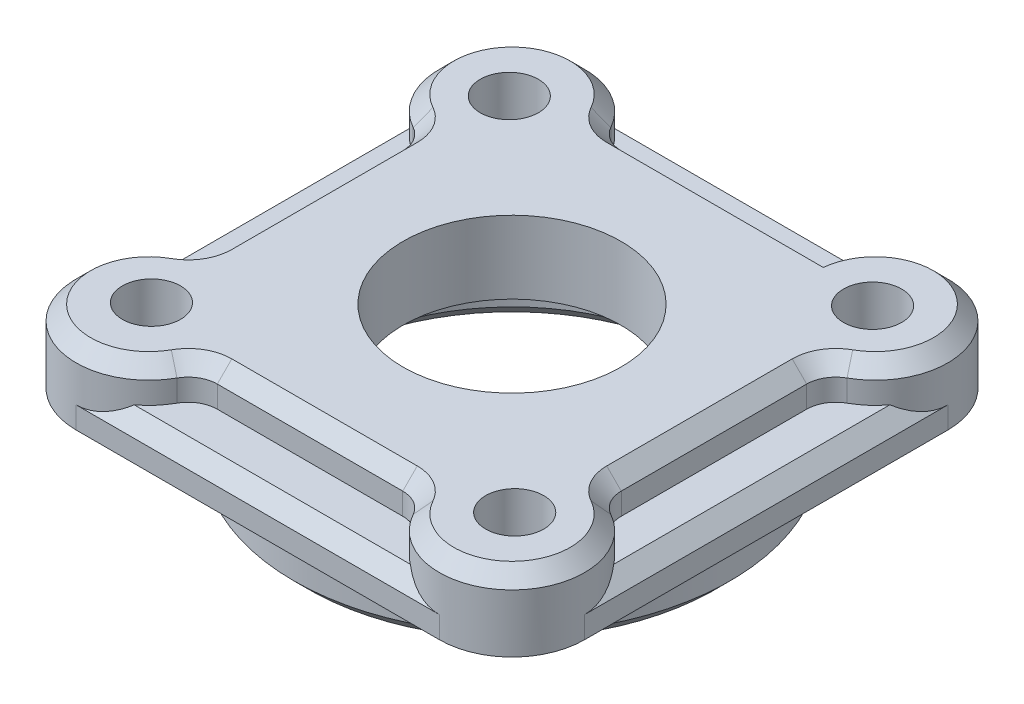
from build123d import *

# Parameters (mm, degrees)
BOSS_EXTRUDE1_DEPTH = 3.175
BOSS_EXTRUDE2_DEPTH = 3.175
SKETCH3_R           = 19.05
SKETCH3_R_2         = 15.875
BOSS_EXTRUDE3_DEPTH = 6.35
SKETCH4_R           = 2.54
CUT_EXTRUDE1_DEPTH  = 34.89972345
CHAMFER1_SIZE       = 1.27
SKETCH5_R           = 9.525
CUT_EXTRUDE2_DEPTH  = 34.89972345


with BuildPart() as part:
    # Sketch1 → Boss-Extrude1 (new body)
    with BuildSketch(Plane(origin=(0, 0, 0), x_dir=(1, 0, 0), z_dir=(0, 1, 0))):
        with BuildLine():
            Line((-15.875, -22.225), (15.875, -22.225))
            ThreePointArc((15.875, -22.225), (20.365128061, -20.365128061), (22.225, -15.875))
            Line((22.225, -15.875), (22.225, 15.875))
            ThreePointArc((22.225, 15.875), (20.365128061, 20.365128061), (15.875, 22.225))
            Line((15.875, 22.225), (-15.875, 22.225))
            ThreePointArc((-15.875, 22.225), (-20.365128061, 20.365128061), (-22.225, 15.875))
            Line((-22.225, 15.875), (-22.225, -15.875))
            ThreePointArc((-22.225, -15.875), (-20.365128061, -20.365128061), (-15.875, -22.225))
        make_face()
    extrude(amount=BOSS_EXTRUDE1_DEPTH)

    # Sketch2 → Boss-Extrude2 (add)
    with BuildSketch(Plane(origin=(0, 3.175, 0), x_dir=(1, 0, 0), z_dir=(0, 1, 0))):
        with BuildLine():
            Line((9.779188038, 17.653644576), (-8.104452463, 17.653644576))
            ThreePointArc((-8.104452463, 17.653644576), (-9.392376749, 18.004386475), (-10.324608902, 18.959746126))
            ThreePointArc((-10.324608902, 18.959746126), (-12.655189283, 21.348145252), (-15.875, 22.225))
            ThreePointArc((-15.875, 22.225), (-20.365128061, 20.365128061), (-22.225, 15.875))
            ThreePointArc((-22.225, 15.875), (-21.348011707, 12.654962289), (-18.959285714, 10.324353044))
            ThreePointArc((-18.959285714, 10.324353044), (-18.003795317, 9.392109345), (-17.653, 8.104094261))
            Line((-17.653, 8.104094261), (-17.653, -8.104094261))
            ThreePointArc((-17.653, -8.104094261), (-18.003795317, -9.392109345), (-18.959285714, -10.324353044))
            ThreePointArc((-18.959285714, -10.324353044), (-21.348011707, -12.654962289), (-22.225, -15.875))
            ThreePointArc((-22.225, -15.875), (-20.365128061, -20.365128061), (-15.875, -22.225))
            ThreePointArc((-15.875, -22.225), (-12.655189283, -21.348145252), (-10.324608902, -18.959746126))
            ThreePointArc((-10.324608902, -18.959746126), (-9.392376749, -18.004386475), (-8.104452463, -17.653644576))
            Line((-8.104452463, -17.653644576), (8.104452463, -17.653644576))
            ThreePointArc((8.104452463, -17.653644576), (9.392376749, -18.004386475), (10.324608902, -18.959746126))
            ThreePointArc((10.324608902, -18.959746126), (12.655189283, -21.348145252), (15.875, -22.225))
            ThreePointArc((15.875, -22.225), (20.365128061, -20.365128061), (22.225, -15.875))
            ThreePointArc((22.225, -15.875), (21.348011707, -12.654962289), (18.959285714, -10.324353044))
            ThreePointArc((18.959285714, -10.324353044), (18.003795317, -9.392109345), (17.653, -8.104094261))
            Line((17.653, -8.104094261), (17.653, 8.104094261))
            ThreePointArc((17.653, 8.104094261), (18.003795317, 9.392109345), (18.959285714, 10.324353044))
            ThreePointArc((18.959285714, 10.324353044), (21.348011707, 12.654962289), (22.225, 15.875))
            ThreePointArc((22.225, 15.875), (20.365128061, 20.365128061), (15.875, 22.225))
            ThreePointArc((15.875, 22.225), (12.065268583, 20.955201426), (9.779188038, 17.653644576))
        make_face()
    extrude(amount=BOSS_EXTRUDE2_DEPTH)

    # Sketch3 → Boss-Extrude3 (add)
    with BuildSketch(Plane.XZ):
        with Locations(Location((0, 0, 0), (0, 0, 90))):
            Circle(SKETCH3_R)
        with Locations(Location((0, 0, 0), (0, 0, 270))):
            Circle(SKETCH3_R_2, mode=Mode.SUBTRACT)
    extrude(amount=BOSS_EXTRUDE3_DEPTH)

    # Sketch4 → Cut-Extrude1 (cut, through all)
    with BuildSketch(Plane(origin=(0, 6.35, 0), x_dir=(1, 0, 0), z_dir=(0, 1, 0))):
        with Locations(Location((-15.875, 15.639418556, 0), (0, 0, 270))):
            Circle(SKETCH4_R)
        with Locations(Location((15.875, 15.639418556, 0), (0, 0, 270))):
            Circle(SKETCH4_R)
        with Locations(Location((-15.875, -15.639418556, 0), (0, 0, 270))):
            Circle(SKETCH4_R)
        with Locations(Location((15.875, -15.639418556, 0), (0, 0, 270))):
            Circle(SKETCH4_R)
    extrude(amount=-CUT_EXTRUDE1_DEPTH, mode=Mode.SUBTRACT)

    # Chamfer1
    chamfer1_edges = [part.edges().sort_by_distance(p)[0] for p in [
        (-20.365314283, 6.35, -20.36494183),
        (-20.365314283, 6.35, 20.36494183),
        (-9.392376749, 6.35, -18.004386475),
        (19.836937806, 6.35, -20.837413609),
        (0.837367788, 6.35, -17.653644576),
        (18.003795317, 6.35, -9.392109345),
        (17.653, 6.35, 0),
        (18.003795317, 6.35, 9.392109345),
        (-18.003795317, 6.35, -9.392109345),
        (20.365314283, 6.35, 20.36494183),
        (-17.653, 6.35, 0),
        (9.392376749, 6.35, 18.004386475),
        (-18.003795317, 6.35, 9.392109345),
        (0, 6.35, 17.653644576),
        (-9.392376749, 6.35, 18.004386475),
    ]]
    chamfer(chamfer1_edges, length=CHAMFER1_SIZE)
    chamfer1_2_edges = [part.edges().sort_by_distance(p)[0] for p in [
        (0, -6.35, -19.05),
    ]]
    chamfer(chamfer1_2_edges, length=CHAMFER1_SIZE)
    chamfer1_3_edges = [part.edges().sort_by_distance(p)[0] for p in [
        (0, -6.35, 15.875),
    ]]
    chamfer(chamfer1_3_edges, length=CHAMFER1_SIZE)
    # the kernel refuses this chamfer: 1.27 mm, written as the material it takes off along each edge
    with BuildSketch(Plane(origin=(-22.225, 3.175, -19.141037395), x_dir=(-0.02749587661058728, -0.9996219169112966, 0), z_dir=(0, 0, 1))) as chamfer1_4_piece_1_section:
        with BuildLine():
            Line((1.306414958, 0), (-0.071814887, 1.304439598))
            Line((-0.071814887, 1.304439598), (-0.097205283, 1.303741203))
            ThreePointArc((-0.097205283, 1.303741203), (-0.043344118, 0.652015244), (-0.025390397, -0.000698395))
            Line((-0.025390397, -0.000698395), (0.000698395, -0.025390397))
            ThreePointArc((0.000698395, -0.025390397), (0.653412034, -0.007436675), (1.307113353, -0.025390397))
            Line((1.307113353, -0.025390397), (1.306414958, 0))
        make_face()
    chamfer1_4_piece_1 = extrude(amount=38.282074789, mode=Mode.PRIVATE)
    chamfer1_4_piece_1 = chamfer1_4_piece_1 - Plane(origin=(-15.875, 2.735416382, -15.875), x_dir=(0, 0, -1), z_dir=(0, -1, 0)) * Cylinder(6.35, 82, mode=Mode.PRIVATE)
    chamfer1_4_piece_1 = chamfer1_4_piece_1 - Plane(origin=(-15.875, 2.735416382, 15.875), x_dir=(-1, 0, 0), z_dir=(0, -1, 0)) * Cylinder(6.35, 82, mode=Mode.PRIVATE)
    add(chamfer1_4_piece_1, mode=Mode.SUBTRACT)
    # the kernel refuses this chamfer: 1.27 mm, written as the material it takes off along each edge
    with BuildSketch(Plane(origin=(19.141037395, 3.175, -22.225), x_dir=(0, -0.9996219169112966, -0.02749587661058728), z_dir=(-1, 0, 0))) as chamfer1_5_piece_1_section:
        with BuildLine():
            Line((1.306414958, 0), (-0.071814887, 1.304439598))
            Line((-0.071814887, 1.304439598), (-0.097205283, 1.303741203))
            ThreePointArc((-0.097205283, 1.303741203), (-0.043344118, 0.652015244), (-0.025390397, -0.000698395))
            Line((-0.025390397, -0.000698395), (0.000698395, -0.025390397))
            ThreePointArc((0.000698395, -0.025390397), (0.653412034, -0.007436675), (1.307113353, -0.025390397))
            Line((1.307113353, -0.025390397), (1.306414958, 0))
        make_face()
    chamfer1_5_piece_1 = extrude(amount=38.282074789, mode=Mode.PRIVATE)
    chamfer1_5_piece_1 = chamfer1_5_piece_1 - Plane(origin=(-15.875, 2.735416382, -15.875), x_dir=(0, 0, -1), z_dir=(0, -1, 0)) * Cylinder(6.35, 82, mode=Mode.PRIVATE)
    chamfer1_5_piece_1 = chamfer1_5_piece_1 - Plane(origin=(15.875, 2.735416382, -15.875), x_dir=(1, 0, 0), z_dir=(0, -1, 0)) * Cylinder(6.35, 82, mode=Mode.PRIVATE)
    add(chamfer1_5_piece_1, mode=Mode.SUBTRACT)
    # the kernel refuses this chamfer: 1.27 mm, written as the material it takes off along each edge
    with BuildSketch(Plane(origin=(-19.141037395, 3.175, 22.225), x_dir=(0, -0.9996219169112966, 0.02749587661058728), z_dir=(1, 0, 0))) as chamfer1_6_piece_1_section:
        with BuildLine():
            Line((1.306414958, 0), (-0.071814887, 1.304439598))
            Line((-0.071814887, 1.304439598), (-0.097205283, 1.303741203))
            ThreePointArc((-0.097205283, 1.303741203), (-0.043344118, 0.652015244), (-0.025390397, -0.000698395))
            Line((-0.025390397, -0.000698395), (0.000698395, -0.025390397))
            ThreePointArc((0.000698395, -0.025390397), (0.653412034, -0.007436675), (1.307113353, -0.025390397))
            Line((1.307113353, -0.025390397), (1.306414958, 0))
        make_face()
    chamfer1_6_piece_1 = extrude(amount=38.282074789, mode=Mode.PRIVATE)
    chamfer1_6_piece_1 = chamfer1_6_piece_1 - Plane(origin=(-15.875, 2.735416383, 15.875), x_dir=(-1, 0, 0), z_dir=(0, -1, 0)) * Cylinder(6.35, 82, mode=Mode.PRIVATE)
    chamfer1_6_piece_1 = chamfer1_6_piece_1 - Plane(origin=(15.875, 2.735416383, 15.875), x_dir=(0, 0, 1), z_dir=(0, -1, 0)) * Cylinder(6.35, 82, mode=Mode.PRIVATE)
    add(chamfer1_6_piece_1, mode=Mode.SUBTRACT)
    # the kernel refuses this chamfer: 1.27 mm, written as the material it takes off along each edge
    with BuildSketch(Plane(origin=(22.225, 3.175, 19.141037395), x_dir=(0.02749587661058728, -0.9996219169112966, 0), z_dir=(0, 0, -1))) as chamfer1_7_piece_1_section:
        with BuildLine():
            Line((1.306414958, 0), (-0.071814887, 1.304439598))
            Line((-0.071814887, 1.304439598), (-0.097205283, 1.303741203))
            ThreePointArc((-0.097205283, 1.303741203), (-0.043344118, 0.652015244), (-0.025390397, -0.000698395))
            Line((-0.025390397, -0.000698395), (0.000698395, -0.025390397))
            ThreePointArc((0.000698395, -0.025390397), (0.653412034, -0.007436675), (1.307113353, -0.025390397))
            Line((1.307113353, -0.025390397), (1.306414958, 0))
        make_face()
    chamfer1_7_piece_1 = extrude(amount=38.282074789, mode=Mode.PRIVATE)
    chamfer1_7_piece_1 = chamfer1_7_piece_1 - Plane(origin=(15.875, 2.735416383, -15.875), x_dir=(1, 0, 0), z_dir=(0, -1, 0)) * Cylinder(6.35, 82, mode=Mode.PRIVATE)
    chamfer1_7_piece_1 = chamfer1_7_piece_1 - Plane(origin=(15.875, 2.735416383, 15.875), x_dir=(0, 0, 1), z_dir=(0, -1, 0)) * Cylinder(6.35, 82, mode=Mode.PRIVATE)
    add(chamfer1_7_piece_1, mode=Mode.SUBTRACT)

    # Sketch5 → Cut-Extrude2 (cut, through all)
    with BuildSketch(Plane(origin=(0, 6.35, 0), x_dir=(1, 0, 0), z_dir=(0, 1, 0))):
        with Locations(Location((0, 0, 0), (0, 0, 270))):
            Circle(SKETCH5_R)
    extrude(amount=-CUT_EXTRUDE2_DEPTH, mode=Mode.SUBTRACT)


solid = part.part
